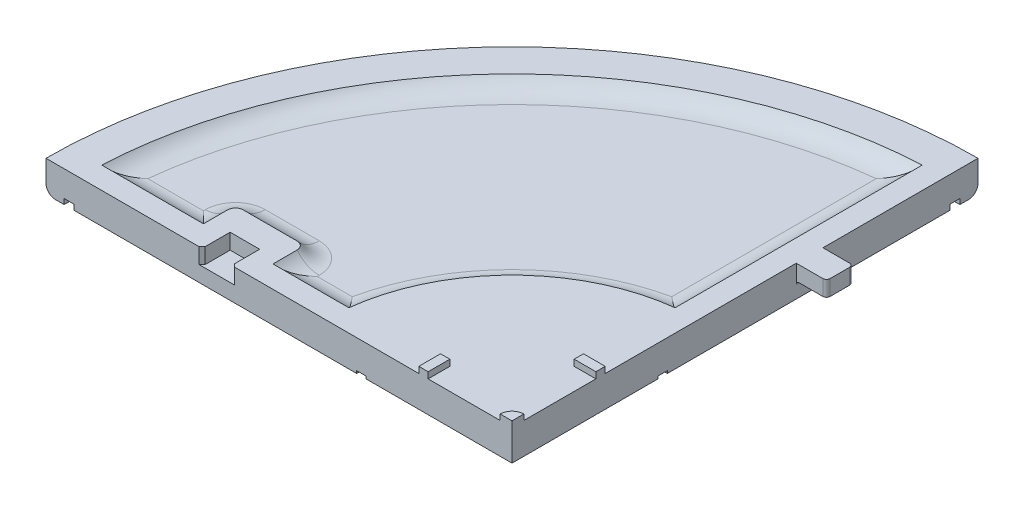
from build123d import *

# Parameters (mm, degrees)
SKETCH1_R            = 150
BOSS_EXTRUDE3_DEPTH  = 10
CUT_EXTRUDE2_DEPTH   = 10
BOSS_EXTRUDE4_DEPTH  = 1.8
SKETCH6_W            = 3
SKETCH6_H            = 7
BOSS_EXTRUDE5_DEPTH  = 2
SKETCH7_W            = 7
SKETCH7_H            = 3
BOSS_EXTRUDE6_DEPTH  = 2
SKETCH8_W            = 10
SKETCH8_H            = 10
CUT_EXTRUDE3_DEPTH   = 5
SKETCH9_W            = 9.193751657
SKETCH9_H            = 8.277315045
BOSS_EXTRUDE7_DEPTH  = 4.35
CHAMFER1_SIZE        = 1
CUT_EXTRUDE4_DEPTH   = 1.7
CUT_EXTRUDE5_DEPTH   = 0.8
FILLET1_R            = 3
FILLET2_R            = 1.4
SKETCH12_W           = 10.671911796
SKETCH12_H           = 9.690192172
CUT_EXTRUDE6_DEPTH   = 11
SKETCH13_W           = 9.731136712
SKETCH13_H           = 8.6
BOSS_EXTRUDE8_DEPTH  = 10
SKETCH14_W           = 9.731136712
SKETCH14_H           = 8.6
CUT_EXTRUDE7_DEPTH   = 5
FILLET3_R            = 1
FILLET4_R            = 1.2
CUT_EXTRUDE8_DEPTH   = 3.5
FILLET5_R            = 2.5
FILLET6_R            = 9
SKETCH16_W           = 0.25
SKETCH16_H           = 5
BOSS_EXTRUDE9_DEPTH  = 11.5
SKETCH17_W           = 9.5
SKETCH17_H           = 5
BOSS_EXTRUDE12_DEPTH = 0.13
SKETCH19_W           = 9.5
SKETCH19_H           = 5
BOSS_EXTRUDE13_DEPTH = 0.85
CHAMFER2_SIZE        = 1


with BuildPart() as part:
    # Sketch1 → Boss-Extrude3 (new body)
    with BuildSketch(Plane(origin=(0, 0, 0), x_dir=(1, 0, 0), z_dir=(0, 1, 0))):
        with Locations(Location((0, 0, 0), (0, 0, 270))):
            Circle(SKETCH1_R)
    extrude(amount=BOSS_EXTRUDE3_DEPTH)

    # Sketch4 → Cut-Extrude2 (cut)
    with BuildSketch(Plane(origin=(0, 10, 0), x_dir=(1, 0, 0), z_dir=(0, 1, 0))):
        Polygon((0, 0), (0, 162.329653064), (183.678217859, 162.329653064), (183.678217859, -176.427761891), (-217.916482153, -176.427761891), (-217.916482153, 0), align=None)
    extrude(amount=-CUT_EXTRUDE2_DEPTH, mode=Mode.SUBTRACT)

    # Sketch5 → Boss-Extrude4 (add)
    with BuildSketch(Plane(origin=(0, 10, 0), x_dir=(1, 0, 0), z_dir=(0, 1, 0))):
        with BuildLine():
            Line((0, 3.825), (0, 0))
            Line((0, 0), (-3.825, 0))
            ThreePointArc((-3.825, 0), (-2.704683438, 2.704683438), (0, 3.825))
        make_face()
    extrude(amount=BOSS_EXTRUDE4_DEPTH)

    # Sketch6 → Boss-Extrude5 (add)
    with BuildSketch(Plane(origin=(0, 10, 0), x_dir=(1, 0, 0), z_dir=(0, 1, 0))):
        with Locations((-28.5, 3.5)):
            Rectangle(SKETCH6_W, SKETCH6_H)
    extrude(amount=BOSS_EXTRUDE5_DEPTH)

    # Sketch7 → Boss-Extrude6 (add)
    with BuildSketch(Plane(origin=(0, 10, 0), x_dir=(1, 0, 0), z_dir=(0, 1, 0))):
        with Locations((-3.5, 28.5)):
            Rectangle(SKETCH7_W, SKETCH7_H)
    extrude(amount=BOSS_EXTRUDE6_DEPTH)

    # Sketch8 → Cut-Extrude3 (cut)
    with BuildSketch(Plane(origin=(0, 10, 0), x_dir=(1, 0, 0), z_dir=(0, 1, 0))):
        with Locations((-95, 5)):
            Rectangle(SKETCH8_W, SKETCH8_H)
    extrude(amount=-CUT_EXTRUDE3_DEPTH, mode=Mode.SUBTRACT)

    # Sketch9 → Boss-Extrude7 (add)
    with BuildSketch(Plane(origin=(0, 10, 0), x_dir=(1, 0, 0), z_dir=(0, 1, 0))):
        with Locations((4.596875828, 95.138657523)):
            Rectangle(SKETCH9_W, SKETCH9_H)
    extrude(amount=-BOSS_EXTRUDE7_DEPTH)

    # Chamfer1
    chamfer1_edges = [part.edges().sort_by_distance(p)[0] for p in [
        (9.193751657, 7.825, -99.277315045),
        (9.193751657, 7.825, -91),
    ]]
    chamfer(chamfer1_edges, length=CHAMFER1_SIZE)

    # Sketch10 → Cut-Extrude4 (cut)
    with BuildSketch(Plane.XZ):
        with BuildLine():
            Line((-140.926536809, 0), (-144.178447036, 0))
            ThreePointArc((-144.178447036, 0), (-101.9495576, -101.9495576), (0, -144.178447036))
            Line((0, -144.178447036), (0, -140.926536809))
            ThreePointArc((0, -140.926536809), (-99.650109827, -99.650109827), (-140.926536809, 0))
        make_face()
    extrude(amount=-CUT_EXTRUDE4_DEPTH, mode=Mode.SUBTRACT)

    # Sketch11 → Cut-Extrude5 (cut)
    with BuildSketch(Plane(origin=(0, 0, 0), x_dir=(-1, 0, 0), z_dir=(0, -1, 0))):
        Polygon((47, 0), (50, 0), (50, 50), (0, 50), (0, 47), (47, 47), align=None)
    extrude(amount=-CUT_EXTRUDE5_DEPTH, mode=Mode.SUBTRACT)

    # Fillet1
    fillet1_edges = [part.edges().sort_by_distance(p)[0] for p in [
        (-106.066017178, 0, -106.066017178),
    ]]
    fillet(fillet1_edges, radius=FILLET1_R)

    # Fillet2
    fillet2_edges = [part.edges().sort_by_distance(p)[0] for p in [
        (0, 5.65, -95.138657523),
    ]]
    fillet(fillet2_edges, radius=FILLET2_R)

    # Sketch12 → Cut-Extrude6 (cut)
    with BuildSketch(Plane(origin=(0, 0, 0), x_dir=(-1, 0, 0), z_dir=(0, -1, 0))):
        with Locations((-5.335955898, 95.265421493)):
            Rectangle(SKETCH12_W, SKETCH12_H)
    extrude(amount=-CUT_EXTRUDE6_DEPTH, mode=Mode.SUBTRACT)

    # Sketch13 → Boss-Extrude8 (add)
    with BuildSketch(Plane(origin=(0, 0, 0), x_dir=(-1, 0, 0), z_dir=(0, -1, 0))):
        with Locations((-4.865568356, 95.8)):
            Rectangle(SKETCH13_W, SKETCH13_H)
    extrude(amount=-BOSS_EXTRUDE8_DEPTH)

    # Sketch14 → Cut-Extrude7 (cut)
    with BuildSketch(Plane(origin=(0, 0, 0), x_dir=(-1, 0, 0), z_dir=(0, -1, 0))):
        with Locations((-4.865568356, 95.8)):
            Rectangle(SKETCH14_W, SKETCH14_H)
    extrude(amount=-CUT_EXTRUDE7_DEPTH, mode=Mode.SUBTRACT)

    # Fillet3
    fillet3_edges = [part.edges().sort_by_distance(p)[0] for p in [
        (0, 5, -95.8),
    ]]
    fillet(fillet3_edges, radius=FILLET3_R)

    # Fillet4
    fillet4_edges = [part.edges().sort_by_distance(p)[0] for p in [
        (9.731136712, 7.5, -91.5),
        (9.731136712, 7.5, -100.1),
    ]]
    fillet(fillet4_edges, radius=FILLET4_R)

    # Sketch15 → Cut-Extrude8 (cut)
    with BuildSketch(Plane(origin=(0, 10, 0), x_dir=(1, 0, 0), z_dir=(0, 1, 0))):
        with BuildLine():
            Line((-84.010224854, 7.071067812), (-84.010224854, 17.341351392))
            Line((-84.010224854, 17.341351392), (-106.385767568, 17.341351392))
            Line((-106.385767568, 17.341351392), (-106.385767568, 7.071067812))
            Line((-106.385767568, 7.071067812), (-139.141411083, 7.071067812))
            ThreePointArc((-139.141411083, 7.071067812), (-98.514801625, 98.514801625), (-7.071067812, 139.141411083))
            Line((-7.071067812, 139.141411083), (-7.071067812, 59.581876439))
            ThreePointArc((-7.071067812, 59.581876439), (-42.426406871, 42.426406871), (-59.581876439, 7.071067812))
            Line((-59.581876439, 7.071067812), (-84.010224854, 7.071067812))
        make_face()
    extrude(amount=-CUT_EXTRUDE8_DEPTH, mode=Mode.SUBTRACT)

    # Fillet5
    fillet5_edges = [part.edges().sort_by_distance(p)[0] for p in [
        (-84.010224854, 8.25, -17.341351392),
        (-106.385767568, 8.25, -17.341351392),
    ]]
    fillet(fillet5_edges, radius=FILLET5_R)

    # Fillet6
    # the kernel refuses this fillet: 9 mm, written as the material it adds along each edge
    with BuildSketch(Plane(origin=(-103.885767568, 6.5, -14.841351392), x_dir=(-1, 0, 0), z_dir=(0, 0, 1))) as fillet6_piece_1:
        with BuildLine():
            CenterArc((9.623903424, -9), FILLET6_R, 90, 52.330113036)
            Line((9.623903424, 0), (2.5, 0))
            Line((2.5, 0), (2.5, -3.5))
        make_face()
    revolve(axis=Axis((-103.885767568, 6.5, -14.841351392), (0, -1, 0)), revolution_arc=90)
    with BuildSketch(Plane(origin=(-86.510224854, 6.5, -14.841351392), x_dir=(0, 0, -1), z_dir=(-1, 0, 0))) as fillet6_piece_2:
        with BuildLine():
            CenterArc((9.623903424, -9), FILLET6_R, 90, 52.330113036)
            Line((9.623903424, 0), (2.5, 0))
            Line((2.5, 0), (2.5, -3.5))
        make_face()
    revolve(axis=Axis((-86.510224854, 6.5, -14.841351392), (0, -1, 0)), revolution_arc=90)
    with BuildSketch(Plane(origin=(0, 6.5, 0), x_dir=(-0.9970291212395074, 0, 0.07702552434340171), z_dir=(0.07702552434340171, 0, 0.9970291212395074))) as fillet6_piece_3_section:
        with BuildLine():
            CenterArc((132.197065128, -9), FILLET6_R, 37.669886964, 52.330113036)
            Line((132.197065128, 0), (139.320968552, 0))
            Line((139.320968552, 0), (139.320968552, -3.5))
        make_face()
    fillet6_piece_3 = revolve(axis=Axis((0, 6.5, 0), (0, -1, 0)), revolution_arc=98.835226115, mode=Mode.PRIVATE)
    fillet6_piece_3 = split(fillet6_piece_3, bisect_by=Plane(origin=(0, 6.5, 0), z_dir=(-1, 0, 0)), keep=Keep.TOP, mode=Mode.PRIVATE)
    fillet6_piece_3 = split(fillet6_piece_3, bisect_by=Plane(origin=(0, 6.5, 0), z_dir=(0, 0, -1)), keep=Keep.TOP, mode=Mode.PRIVATE)
    add(fillet6_piece_3)
    with BuildSketch(Plane(origin=(-88.576009007, 6.5, -7.071067812), x_dir=(0, 1, 0), z_dir=(-1, 0, 0))) as fillet6_piece_4_section:
        with BuildLine():
            CenterArc((9, 7.123903424), FILLET6_R, 180, 52.330113036)
            Line((0, 7.123903424), (0, 0))
            Line((0, 0), (3.5, 0))
        make_face()
    fillet6_piece_4 = extrude(amount=68.375160637, mode=Mode.PRIVATE)
    fillet6_piece_4 = fillet6_piece_4 & Plane(origin=(0, 6.5, 0), x_dir=(0, 0, 1), z_dir=(0, -1, 0)) * Cylinder(150, 166, mode=Mode.PRIVATE)
    fillet6_piece_4 = split(fillet6_piece_4, bisect_by=Plane(origin=(-100, 6.5, -7.071067812), z_dir=(-1, 0, 0)), keep=Keep.TOP, mode=Mode.PRIVATE)
    add(fillet6_piece_4)
    with BuildSketch(Plane(origin=(-86.510224854, 6.5, -17.341351392), x_dir=(0, 1, 0), z_dir=(-1, 0, 0))) as fillet6_piece_5:
        with BuildLine():
            CenterArc((9, 7.123903424), FILLET6_R, 180, 52.330113036)
            Line((0, 7.123903424), (0, 0))
            Line((0, 0), (3.5, 0))
        make_face()
    extrude(amount=17.375542715)
    with BuildSketch(Plane(origin=(-41.772117878, 6.5, -7.071067812), x_dir=(0, 1, 0), z_dir=(-1, 0, 0))) as fillet6_piece_6_section:
        with BuildLine():
            CenterArc((9, 7.123903424), FILLET6_R, 180, 52.330113036)
            Line((0, 7.123903424), (0, 0))
            Line((0, 0), (3.5, 0))
        make_face()
    fillet6_piece_6 = extrude(amount=60.047865536, mode=Mode.PRIVATE)
    fillet6_piece_6 = split(fillet6_piece_6, bisect_by=Plane(origin=(-90, 6.5, -7.071067812), z_dir=(1, 0, 0)), keep=Keep.TOP, mode=Mode.PRIVATE)
    add(fillet6_piece_6)
    with BuildSketch(Plane(origin=(-7.071067812, 6.5, -156.951169644), x_dir=(0, 1, 0), z_dir=(0, 0, 1))) as fillet6_piece_7_section:
        with BuildLine():
            CenterArc((9, 7.123903424), FILLET6_R, 180, 52.330113036)
            Line((0, 7.123903424), (0, 0))
            Line((0, 0), (3.5, 0))
        make_face()
    fillet6_piece_7 = extrude(amount=115.179051766, mode=Mode.PRIVATE)
    fillet6_piece_7 = fillet6_piece_7 & Plane(origin=(0, 6.5, 0), x_dir=(0, 0, 1), z_dir=(0, -1, 0)) * Cylinder(150, 259, mode=Mode.PRIVATE)
    add(fillet6_piece_7)
    with BuildSketch(Plane(origin=(0, 6.5, 0), x_dir=(0.17783871438849583, 0, -0.9840596484282074), z_dir=(0.9840596484282074, 0, 0.17783871438849583))) as fillet6_piece_8_section:
        with BuildLine():
            CenterArc((67.123903424, 9), FILLET6_R, 217.669886964, 52.330113036)
            Line((67.123903424, 0), (60, 0))
            Line((60, 0), (60, 3.5))
        make_face()
    fillet6_piece_8 = revolve(axis=Axis((0, 6.5, 0), (0, 1, 0)), revolution_arc=110.487792536, mode=Mode.PRIVATE)
    fillet6_piece_8 = split(fillet6_piece_8, bisect_by=Plane(origin=(0, 6.5, 0), z_dir=(-1, 0, 0)), keep=Keep.TOP, mode=Mode.PRIVATE)
    fillet6_piece_8 = split(fillet6_piece_8, bisect_by=Plane(origin=(0, 6.5, 0), z_dir=(0, 0, -1)), keep=Keep.TOP, mode=Mode.PRIVATE)
    add(fillet6_piece_8)
    with BuildSketch(Plane(origin=(-84.010224854, 6.5, 10.738690749), x_dir=(0, 1, 0), z_dir=(0, 0, -1))) as fillet6_piece_9_section:
        with BuildLine():
            CenterArc((9, 7.123903424), FILLET6_R, 180, 52.330113036)
            Line((0, 7.123903424), (0, 0))
            Line((0, 0), (3.5, 0))
        make_face()
    fillet6_piece_9 = extrude(amount=25.580042141, mode=Mode.PRIVATE)
    fillet6_piece_9 = split(fillet6_piece_9, bisect_by=Plane(origin=(-84.010224854, 6.5, 0), z_dir=(0, 0, -1)), keep=Keep.TOP, mode=Mode.PRIVATE)
    add(fillet6_piece_9)
    with BuildSketch(Plane(origin=(-106.385767568, 6.5, -14.841351392), x_dir=(0, 1, 0), z_dir=(0, 0, 1))) as fillet6_piece_10_section:
        with BuildLine():
            CenterArc((9, 7.123903424), FILLET6_R, 180, 52.330113036)
            Line((0, 7.123903424), (0, 0))
            Line((0, 0), (3.5, 0))
        make_face()
    fillet6_piece_10 = extrude(amount=25.580042141, mode=Mode.PRIVATE)
    fillet6_piece_10 = split(fillet6_piece_10, bisect_by=Plane(origin=(-106.385767568, 6.5, 0), z_dir=(0, 0, -1)), keep=Keep.TOP, mode=Mode.PRIVATE)
    add(fillet6_piece_10)

    # Sketch16 → Boss-Extrude9 (add)
    with BuildSketch(Plane.XY):
        with Locations((-99.875, 7.5)):
            Rectangle(SKETCH16_W, SKETCH16_H)
        with Locations((-90.125, 7.5)):
            Rectangle(SKETCH16_W, SKETCH16_H)
    extrude(amount=-BOSS_EXTRUDE9_DEPTH)

    # Sketch17 → Boss-Extrude12 (add)
    with BuildSketch(Plane.XY.offset(-10)):
        with Locations((-95, 7.5)):
            Rectangle(SKETCH17_W, SKETCH17_H)
    extrude(amount=BOSS_EXTRUDE12_DEPTH)

    # Sketch19 → Boss-Extrude13 (add)
    with BuildSketch(Plane.XY.offset(-9.87)):
        with Locations((-95, 7.5)):
            Rectangle(SKETCH19_W, SKETCH19_H)
    extrude(amount=BOSS_EXTRUDE13_DEPTH)

    # Chamfer2
    chamfer2_edges = [part.edges().sort_by_distance(p)[0] for p in [
        (-99.75, 7.5, 0),
        (-90.25, 7.5, 0),
    ]]
    chamfer(chamfer2_edges, length=CHAMFER2_SIZE)


solid = part.part
